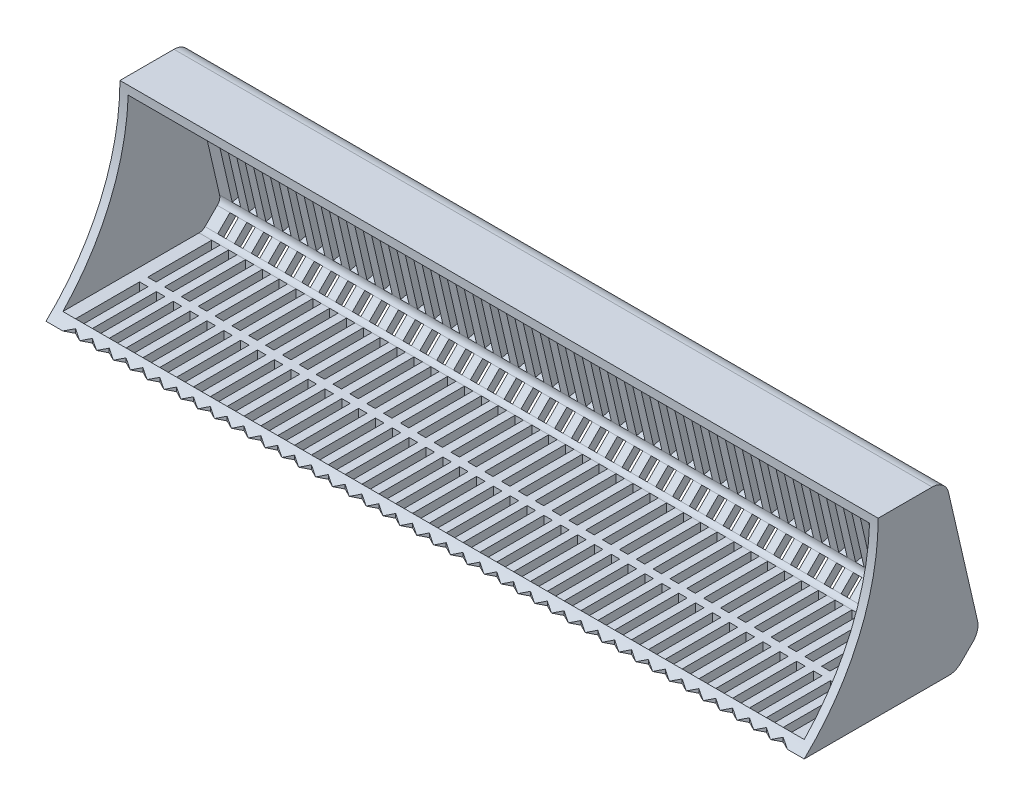
from build123d import *

# Parameters (mm, degrees)
BOSS_EXTRUDE1_DEPTH = 225
FILLET2_R           = 10
SHELL2_T            = -5
SKETCH2_W           = 5
SKETCH2_H           = 38
CUT_EXTRUDE1_DEPTH  = 252.761198249
LPATTERN1_COUNT     = 22
LPATTERN1_PITCH     = 10
LPATTERN1_COL_COUNT = 22
LPATTERN1_COL_PITCH = 10
SKETCH3_W           = 5
SKETCH3_H           = 10.314773862
CUT_EXTRUDE2_DEPTH  = 10
LPATTERN2_COUNT     = 22
LPATTERN2_PITCH     = 10
LPATTERN2_COL_COUNT = 22
LPATTERN2_COL_PITCH = 10
SKETCH4_W           = 5
SKETCH4_H           = 35.751275159
SKETCH4_H_2         = 35.75127516
CUT_EXTRUDE3_DEPTH  = 262.671589381
LPATTERN3_COUNT     = 22
LPATTERN3_PITCH     = 10
LPATTERN3_COL_COUNT = 22
LPATTERN3_COL_PITCH = 10


with BuildPart() as part:
    # Sketch1 → Boss-Extrude1 (new, symmetric)
    with BuildSketch(Plane(origin=(0, 0, 0), x_dir=(0, 0, -1), z_dir=(1, 0, 0))):
        with BuildLine():
            Line((-45, 0), (45, 0))
            Line((45, 0), (59.142135624, 14.142135624))
            Line((59.142135624, 14.142135624), (38.896540733, 101.835441454))
            Line((38.896540733, 101.835441454), (-1.103459267, 101.835441454))
            ThreePointArc((-1.103459267, 101.835441454), (-12.544875138, 46.388702541), (-45, 0))
        make_face()
    extrude(amount=BOSS_EXTRUDE1_DEPTH, both=True)

    # Fillet2
    fillet2_edges = [part.edges().sort_by_distance(p)[0] for p in [
        (0, 101.835441454, -38.896540733),
        (0, 14.142135624, -59.142135624),
        (0, 0, -45),
    ]]
    fillet(fillet2_edges, radius=FILLET2_R)

    # Shell2
    shell2_openings = [part.faces().sort_by_distance(p)[0] for p in [
        (0, 46.388702541, 12.544875138),
    ]]
    offset(amount=SHELL2_T, openings=shell2_openings, kind=Kind.INTERSECTION)

    # Sketch2 → Cut-Extrude1 (cut, through all)
    with BuildSketch(Plane(origin=(0, 5, 0), x_dir=(1, 0, 0), z_dir=(0, 1, 0))):
        with Locations((0, -20.967395714)):
            Rectangle(SKETCH2_W, SKETCH2_H)
        with Locations((0, 21.857864376)):
            Rectangle(SKETCH2_W, SKETCH2_H)
        Polygon((2.5, -45), (5, -45), (0, -42.467395714), (-5, -45), (-2.5, -45), align=None)
        Polygon((-5, -45), (0, -42.467395714), (5, -45), align=None)
    cut_extrude1 = extrude(amount=-CUT_EXTRUDE1_DEPTH, mode=Mode.SUBTRACT)

    # LPattern1: Cut-Extrude1 ×22
    with Locations(*[(i * LPATTERN1_PITCH, 0, 0) for i in range(1, LPATTERN1_COUNT)]):
        add(cut_extrude1, mode=Mode.SUBTRACT)

    # LPattern1 col: Cut-Extrude1 ×22
    with Locations(*[(-i * LPATTERN1_COL_PITCH, 0, 0) for i in range(1, LPATTERN1_COL_COUNT)]):
        add(cut_extrude1, mode=Mode.SUBTRACT)

    # Sketch3 → Cut-Extrude2 (cut)
    with BuildSketch(Plane(origin=(0, -18.964466094, -18.964466094), x_dir=(1, 0, 0), z_dir=(0, 0.7071067811865461, 0.7071067811865489))):
        with Locations((0, 41.119327708)):
            Rectangle(SKETCH3_W, SKETCH3_H)
    cut_extrude2 = extrude(amount=-CUT_EXTRUDE2_DEPTH, mode=Mode.SUBTRACT)

    # LPattern2: Cut-Extrude2 ×22
    with Locations(*[(i * LPATTERN2_PITCH, 0, 0) for i in range(1, LPATTERN2_COUNT)]):
        add(cut_extrude2, mode=Mode.SUBTRACT)

    # LPattern2 col: Cut-Extrude2 ×22
    with Locations(*[(-i * LPATTERN2_COL_PITCH, 0, 0) for i in range(1, LPATTERN2_COL_COUNT)]):
        add(cut_extrude2, mode=Mode.SUBTRACT)

    # Sketch4 → Cut-Extrude3 (cut, through all)
    with BuildSketch(Plane(origin=(0, 12.553981798, -54.377269286), x_dir=(1, 0, 0), z_dir=(0, -0.2249510543438698, 0.9743700647852341))):
        with Locations((0, 23.894315934)):
            Rectangle(SKETCH4_W, SKETCH4_H)
        with Locations((0, 64.645591093)):
            Rectangle(SKETCH4_W, SKETCH4_H_2)
    cut_extrude3 = extrude(amount=-CUT_EXTRUDE3_DEPTH, mode=Mode.SUBTRACT)

    # LPattern3: Cut-Extrude3 ×22
    with Locations(*[(i * LPATTERN3_PITCH, 0, 0) for i in range(1, LPATTERN3_COUNT)]):
        add(cut_extrude3, mode=Mode.SUBTRACT)

    # LPattern3 col: Cut-Extrude3 ×22
    with Locations(*[(-i * LPATTERN3_COL_PITCH, 0, 0) for i in range(1, LPATTERN3_COL_COUNT)]):
        add(cut_extrude3, mode=Mode.SUBTRACT)


solid = part.part
